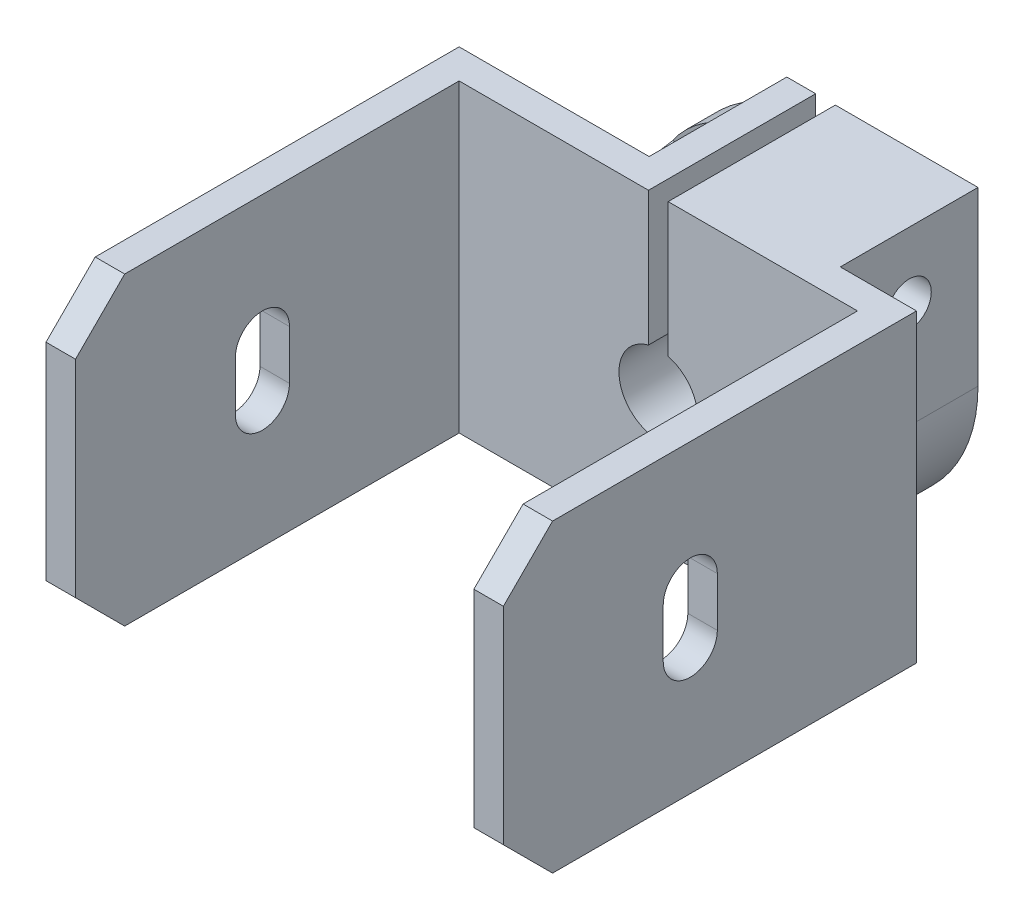
from build123d import *

# Parameters (mm, degrees)
SKETCH1_R                    = 4
SKETCH1_R_2                  = 2.249999999999999
BOSS_EXTRUDE1_DEPTH          = 24
SKETCH2_R                    = 2.2499999999999956
SKETCH2_R_2                  = 4
BOSS_EXTRUDE2_DEPTH          = 24
CUT_EXTRUDE1_DEPTH           = 14
CUT_EXTRUDE2_START           = -14
CUT_EXTRUDE2_DEPTH           = 14
BOSS_EXTRUDE3_DEPTH          = 2
CUT_EXTRUDE_THIN1_DEPTH      = 70.97528134991671
CUT_EXTRUDE_THIN1_DEPTH_BACK = 53.00000000000001
SKETCH6_W                    = 2
SKETCH6_H                    = 35.40537681916631
SKETCH7_R                    = 2.249999999999999
CUT_EXTRUDE3_DEPTH           = 55.524673314014464
CUT_EXTRUDE4_DEPTH           = 41.99999999999999
CHAMFER2_SIZE                = 1
SKETCH9_R                    = 45.63024731549585
CUT_EXTRUDE5_DEPTH           = 2
SKETCH10_R                   = 89.28313808685371
CUT_EXTRUDE6_DEPTH           = 57.00000000000001
BOSS_EXTRUDE5_START          = 3
SKETCH11_R                   = 3.9999999999999925
BOSS_EXTRUDE5_DEPTH          = 3
BOSS_EXTRUDE6_DEPTH          = 3
BOSS_EXTRUDE7_DEPTH          = 3
CUT_EXTRUDE7_DEPTH           = 56.55663776723714
CUT_EXTRUDE7_DEPTH_BACK      = 56.55663776723714
CUT_EXTRUDE8_START           = -18.000000000000004
CUT_EXTRUDE8_DEPTH           = 18.000000000000004
CHAMFER4_SIZE                = 5


with BuildPart() as part:
    # Sketch1 → Boss-Extrude1 (new body)
    with BuildSketch(Plane.XY):
        with BuildLine():
            Line((0, 15.5), (-30, 15.5))
            Line((-30, 15.5), (-45.50000000000001, 15.499999999999995))
            Line((-45.50000000000001, 15.499999999999995), (-45.5, 1.9e-15))
            ThreePointArc((-45.5, 1.9e-15), (-40.96015510839149, -10.960155108391486), (-30, -15.499999999999996))
            Line((-30, -15.499999999999996), (0, -15.5))
            ThreePointArc((0, -15.5), (10.960155108391488, -10.960155108391486), (15.5, 0))
            Line((15.5, 0), (15.5, 15.5))
            Line((15.5, 15.5), (0, 15.5))
        make_face()
        Circle(SKETCH1_R, mode=Mode.SUBTRACT)
        with Locations((-30, 0)):
            Circle(SKETCH1_R_2, mode=Mode.SUBTRACT)
    extrude(amount=BOSS_EXTRUDE1_DEPTH)

    # Sketch4 → Cut-Extrude2 (cut)
    with BuildSketch(Plane.XY.offset(24).offset(CUT_EXTRUDE2_START)):
        with BuildLine():
            Line((-1.32e-15, 15.499999999999998), (-45.50000000000001, 15.499999999999995))
            Line((-45.50000000000001, 15.499999999999995), (-45.5, 1.9e-15))
            ThreePointArc((-45.5, 1.9e-15), (-40.96015510839149, -10.960155108391486), (-30.000000000000004, -15.5))
            Line((-30.000000000000004, -15.5), (0, -15.5))
            ThreePointArc((0, -15.5), (-15.499999999999998, 1.9e-15), (-1.32e-15, 15.499999999999998))
        make_face()
    extrude(amount=CUT_EXTRUDE2_DEPTH, mode=Mode.SUBTRACT)



with BuildPart() as body_2:
    # Sketch2 → Boss-Extrude2 (new body)
    with BuildSketch(Plane(origin=(0, 0, -2.2), x_dir=(-1, 0, 0), z_dir=(0, 0, -1))):
        with BuildLine():
            Line((-2.85e-15, -15.5), (30.000000000000004, -15.499999999999998))
            ThreePointArc((30.000000000000004, -15.499999999999998), (40.96015510839149, -10.960155108391485), (45.5, 0))
            Line((45.5, 0), (45.50000000000001, 15.499999999999995))
            Line((45.50000000000001, 15.499999999999995), (-15.5, 15.5))
            Line((-15.5, 15.5), (-15.5, 1.73e-15))
            ThreePointArc((-15.5, 1.73e-15), (-10.96015510839149, -10.960155108391486), (-2.85e-15, -15.5))
        make_face()
        with Locations((30, 0)):
            Circle(SKETCH2_R, mode=Mode.SUBTRACT)
        Circle(SKETCH2_R_2, mode=Mode.SUBTRACT)
    extrude(amount=BOSS_EXTRUDE2_DEPTH)

    # Sketch3 → Cut-Extrude1 (cut)
    with BuildSketch(Plane(origin=(0, 0, -26.200000000000003), x_dir=(-1, 0, 0), z_dir=(0, 0, -1))):
        with BuildLine():
            Line((-2.85e-15, -15.5), (30.000000000000004, -15.499999999999998))
            ThreePointArc((30.000000000000004, -15.499999999999998), (40.96015510839149, -10.960155108391485), (45.5, 0))
            Line((45.5, 0), (45.50000000000001, 15.499999999999995))
            Line((45.50000000000001, 15.499999999999995), (1.32e-15, 15.499999999999998))
            ThreePointArc((1.32e-15, 15.499999999999998), (15.5, -3.44e-15), (-2.85e-15, -15.5))
        make_face()
    extrude(amount=-CUT_EXTRUDE1_DEPTH, mode=Mode.SUBTRACT)


with BuildPart() as part_1:
    add(part.part)

    add(body_2.part)  # Boss-Extrude3 merges body 2
    # Sketch5 → Boss-Extrude3 (add)
    with BuildSketch(Plane(origin=(-1.32e-15, 15.499999999999998, 0), x_dir=(1, 1.1e-16, 0), z_dir=(-1.1e-16, 1, 0))):
        Polygon((-45.50000000000001, 12.200000000000001), (1.77e-15, 12.200000000000001), (0, 26.200000000000003), (15.500000000000002, 26.200000000000003), (15.500000000000002, -24), (0, -24), (1.77e-15, -10), (-45.50000000000001, -10), (-45.50000000000001, 0), (-38.50000000000001, 0), (-38.50000000000001, 2.200000000000001), (-45.50000000000001, 2.2), align=None)
    extrude(amount=BOSS_EXTRUDE3_DEPTH)

    # Chamfer1
    # the kernel refuses this chamfer: 10 mm, written as the material it adds along each edge
    with BuildSketch(Plane(origin=(-3.72e-15, 15.5, 10), x_dir=(0.026587242345483465, 0.9996464967899715, 0), z_dir=(0, 0, 1))) as chamfer1_piece_1_section:
        with BuildLine():
            Line((8.29406545002713, 1e-17), (-1.7422154358514688, 6.254838102034438))
            Line((-1.7422154358514688, 6.254838102034438), (-1.9240447967842007, 6.17154294309471))
            ThreePointArc((-1.9240447967842007, 6.17154294309471), (-0.6239231337177482, 3.187248798266774), (-0.19992929935799358, -0.00531744846909673))
            Line((-0.19992929935799358, -0.00531744846909673), (0.00531744846909669, -0.1999292993579943))
            ThreePointArc((0.00531744846909669, -0.1999292993579943), (4.149418712953845, -0.08971011189834381), (8.299382898496228, -0.19992929935799428))
            Line((8.299382898496228, -0.19992929935799428), (8.29406545002713, 1e-17))
        make_face()
    chamfer1_piece_1 = extrude(amount=14, mode=Mode.PRIVATE)
    chamfer1_piece_1 = split(chamfer1_piece_1, bisect_by=Plane(origin=(-2.6872969980278754, 17.5, 17.000000000000004), z_dir=(1.1e-16, -1, 0)), keep=Keep.TOP, mode=Mode.PRIVATE)
    add(chamfer1_piece_1)
    with BuildSketch(Plane(origin=(-1.32e-15, 15.5, -26.200000000000003), x_dir=(-0.9701220678115945, -0.24261733974503139, 0), z_dir=(0, 0, 1))) as chamfer1_piece_2_section:
        with BuildLine():
            Line((6.4929434240243395, 9e-17), (-2.2255005025199233, -7.9899104627409505))
            Line((-2.2255005025199233, -7.9899104627409505), (-2.419524916082242, -7.941386994791944))
            ThreePointArc((-2.419524916082242, -7.941386994791944), (-1.1998107866971348, -3.973182305874418), (-0.19402441356231892, 0.04852346794900628))
            Line((-0.19402441356231892, 0.04852346794900628), (0.0485234679490061, 0.1940244135623182))
            ThreePointArc((0.0485234679490061, 0.1940244135623182), (3.237781752513792, -0.25417376326036684), (6.461492077353489, 0.19751155103585727))
            Line((6.461492077353489, 0.19751155103585727), (6.4929434240243395, 9e-17))
        make_face()
    chamfer1_piece_2 = extrude(amount=14, mode=Mode.PRIVATE)
    chamfer1_piece_2 = split(chamfer1_piece_2, bisect_by=Plane(origin=(-2.687296998027888, 17.5, -19.200000000000006), z_dir=(1.1e-16, -1, 0)), keep=Keep.TOP, mode=Mode.PRIVATE)
    add(chamfer1_piece_2)

    # Sketch6 → Cut-Extrude-Thin1 (cut, two sides: drawn at the far end of the back side and taken through both)
    with BuildSketch(Plane(origin=(0, 0, -26.200000000000003), x_dir=(-1, 0, 0), z_dir=(0, 0, -1)).offset(-CUT_EXTRUDE_THIN1_DEPTH_BACK)):
        with Locations((0, 17.702688409583153)):
            Rectangle(SKETCH6_W, SKETCH6_H)
    extrude(amount=CUT_EXTRUDE_THIN1_DEPTH + CUT_EXTRUDE_THIN1_DEPTH_BACK, mode=Mode.SUBTRACT)

    # Sketch7 → Cut-Extrude3 (cut, symmetric)
    with BuildSketch(Plane(origin=(-1, 0, 0), x_dir=(0, 0, -1), z_dir=(1, 0, 0))):
        with Locations((19.200000000000006, 10.686491673103705)):
            Circle(SKETCH7_R)
    cut_extrude3 = extrude(amount=CUT_EXTRUDE3_DEPTH, both=True, mode=Mode.SUBTRACT)

    # Mirror1: Cut-Extrude3 across plane
    add(cut_extrude3.mirror(Plane(origin=(0, 0, -1.1000000000000003), x_dir=(1, 0, 0), z_dir=(0, 0, -1))), mode=Mode.SUBTRACT)

    # Sketch8 → Cut-Extrude4 (cut)
    with BuildSketch(Plane.ZY.offset(45.50000000000001)):
        Polygon((-15.1788975572378, 12.292958337809747), (-18.58068972058721, 14.97210187210845), (-22.60179216334942, 13.365635207402391), (-23.221102442762213, 9.080025008397632), (-19.8193102794128, 6.4008814740989255), (-15.798207836650597, 8.007348138804984), align=None)
        Polygon((12.978897557237794, 12.292958337809734), (13.598207836650598, 8.007348138804979), (17.61931027941281, 6.400881474098927), (21.02110244276222, 9.080025008397646), (20.401792163349413, 13.365635207402406), (16.38068972058721, 14.972101872108457), align=None)
    extrude(amount=-CUT_EXTRUDE4_DEPTH, mode=Mode.SUBTRACT)

    # Chamfer2
    chamfer2_edges = [part_1.edges().sort_by_distance(p)[0] for p in [
        (-2.449489742783177, -3.1622776601683804, 24),
        (-1.22e-15, -4, -26.2),
    ]]
    chamfer(chamfer2_edges, length=CHAMFER2_SIZE)

    # Sketch9 → Cut-Extrude5 (cut)
    with BuildSketch(Plane(origin=(-1.79e-15, -15.5, 0), x_dir=(-1, 1.2e-16, 0), z_dir=(-1.2e-16, -1, 0))):
        with Locations((14.602356379640469, -2.8500724208981865)):
            Circle(SKETCH9_R)
    extrude(amount=-CUT_EXTRUDE5_DEPTH, mode=Mode.SUBTRACT)

    # Sketch10 → Cut-Extrude6 (cut)
    with BuildSketch(Plane(origin=(0, 0, -12.200000000000001), x_dir=(-1, 0, 0), z_dir=(0, 0, -1))):
        with Locations((18.92287737663878, -1.4489467579892334)):
            Circle(SKETCH10_R)
    extrude(amount=-CUT_EXTRUDE6_DEPTH, mode=Mode.SUBTRACT)

    # Sketch11 → Boss-Extrude5 (add)
    with BuildSketch(Plane.XY.offset(-12.200000000000001).offset(BOSS_EXTRUDE5_START)):
        Polygon((-20.25, 17.499999999999996), (20.250000000000004, 17.499999999999996), (20.250000000000007, -13.499999999999998), (-20.249999999999993, -13.499999999999998), align=None)
        Circle(SKETCH11_R, mode=Mode.SUBTRACT)
    extrude(amount=-BOSS_EXTRUDE5_DEPTH)

    # Sketch13 → Boss-Extrude6 (add)
    with BuildSketch(Plane(origin=(20.250000000000007, 2.27e-15, 0), x_dir=(0, 0, -1), z_dir=(1, 1.1e-16, 0))):
        Polygon((12.200000000000001, 17.499999999999993), (-29.8, 17.499999999999993), (-29.8, -13.500000000000002), (12.200000000000005, -13.500000000000002), align=None)
    extrude(amount=BOSS_EXTRUDE6_DEPTH)

    # Sketch14 → Boss-Extrude7 (add)
    with BuildSketch(Plane.ZY.offset(20.249999999999996)):
        Polygon((-12.200000000000001, -13.499999999999993), (29.8, -13.499999999999993), (29.8, 17.499999999999996), (-12.200000000000001, 17.5), align=None)
    extrude(amount=BOSS_EXTRUDE7_DEPTH)

    # Sketch15 → Cut-Extrude7 (cut, two sides: drawn at the far end of the back side and taken through both)
    with BuildSketch(Plane.ZY.offset(-20.250000000000007).offset(-CUT_EXTRUDE7_DEPTH_BACK)):
        with BuildLine():
            Line((8.05, -0.5000000000000039), (8.05, 4.499999999999997))
            ThreePointArc((8.05, 4.499999999999997), (10.8, 7.249999999999999), (13.550000000000002, 4.499999999999997))
            Line((13.550000000000002, 4.499999999999997), (13.55, -0.5000000000000034))
            ThreePointArc((13.55, -0.5000000000000034), (10.8, -3.2500000000000036), (8.05, -0.5000000000000039))
        make_face()
    extrude(amount=CUT_EXTRUDE7_DEPTH + CUT_EXTRUDE7_DEPTH_BACK, mode=Mode.SUBTRACT)

    # Sketch16 → Cut-Extrude8 (cut)
    with BuildSketch(Plane(origin=(0, 0, -12.200000000000001), x_dir=(-1, 0, 0), z_dir=(0, 0, -1)).offset(CUT_EXTRUDE8_START)):
        with BuildLine():
            Line((-1, 17.499999999999996), (-1, 3.8729833462074166))
            ThreePointArc((-1, 3.8729833462074166), (-4.8e-16, 4), (0.9999999999999991, 3.8729833462074157))
            Line((0.9999999999999991, 3.8729833462074157), (1.0000000000000009, 17.499999999999996))
            Line((1.0000000000000009, 17.499999999999996), (-1, 17.499999999999996))
        make_face()
    extrude(amount=CUT_EXTRUDE8_DEPTH, mode=Mode.SUBTRACT)

    # Chamfer4
    chamfer4_edges = [part_1.edges().sort_by_distance(p)[0] for p in [
        (21.750000000000004, 17.499999999999996, 29.8),
        (21.750000000000007, -13.5, 29.8),
        (-21.749999999999993, -13.499999999999998, 29.8),
        (-21.75, 17.499999999999993, 29.8),
    ]]
    chamfer(chamfer4_edges, length=CHAMFER4_SIZE)


solid = part_1.part
